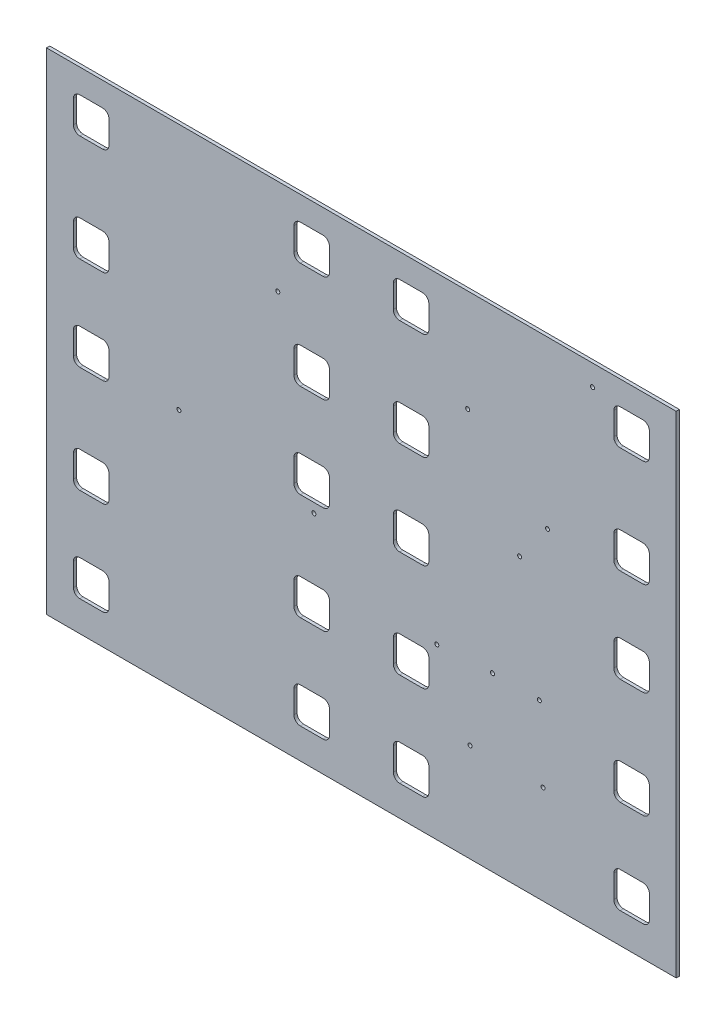
from build123d import *

# Parameters (mm, degrees)
BOSS_EXTRUDE2_DEPTH  = 3.175
CUT_EXTRUDE6_DEPTH   = 570.66376491
LPATTERN2_COUNT      = 2
LPATTERN2_PITCH      = 217.5764
MIRROR1_COPY_1_DEPTH = 570.66376491
SKETCH11_R           = 1.9939
CUT_EXTRUDE7_DEPTH   = 570.66376491


with BuildPart() as part:
    # Sketch9 → Boss-Extrude2 (new body)
    with BuildSketch(Plane.XY):
        Polygon((-144.32459706, -311.513538284), (476.933999514, -311.448288512), (476.883139425, 172.802708817), (-144.375457148, 172.737459045), align=None)
    extrude(amount=BOSS_EXTRUDE2_DEPTH)

    # Sketch10 → Cut-Extrude6 (cut, through all)
    with BuildSketch(Plane.XY.offset(3.175)):
        with BuildLine():
            ThreePointArc((-111.536959772, -153.814293782), (-116.026892468, -155.674637302), (-117.886292807, -160.164960678))
            Line((-117.886292807, -160.164960678), (-117.883937231, -182.592960554))
            ThreePointArc((-117.883937231, -182.592960554), (-116.023593711, -187.08289325), (-111.533270336, -188.942293589))
            Line((-111.533270336, -188.942293589), (-89.105270459, -188.939938013))
            ThreePointArc((-89.105270459, -188.939938013), (-84.615337763, -187.079594493), (-82.755937424, -182.589271118))
            Line((-82.755937424, -182.589271118), (-82.758293001, -160.161271241))
            ThreePointArc((-82.758293001, -160.161271241), (-84.618636521, -155.671338545), (-89.108959896, -153.811938206))
            Line((-89.108959896, -153.811938206), (-111.536959772, -153.814293782))
        make_face()
        with BuildLine():
            ThreePointArc((-111.52723579, -246.397293272), (-116.017168486, -248.257636792), (-117.876568825, -252.747960167))
            Line((-117.876568825, -252.747960167), (-117.874213249, -275.175960043))
            ThreePointArc((-117.874213249, -275.175960043), (-116.013869729, -279.66589274), (-111.523546354, -281.525293078))
            Line((-111.523546354, -281.525293078), (-89.095546477, -281.522937502))
            ThreePointArc((-89.095546477, -281.522937502), (-84.605613781, -279.662593982), (-82.746213443, -275.172270607))
            Line((-82.746213443, -275.172270607), (-82.748569019, -252.744270731))
            ThreePointArc((-82.748569019, -252.744270731), (-84.608912539, -248.254338034), (-89.099235914, -246.394937696))
            Line((-89.099235914, -246.394937696), (-111.52723579, -246.397293272))
        make_face()
        with BuildLine():
            ThreePointArc((-82.769334554, -55.030671821), (-84.629678074, -50.540739125), (-89.120001449, -48.681338786))
            Line((-89.120001449, -48.681338786), (-111.548001325, -48.683694362))
            ThreePointArc((-111.548001325, -48.683694362), (-116.037934022, -50.544037882), (-117.89733436, -55.034361257))
            Line((-117.89733436, -55.034361257), (-117.894978784, -77.462361134))
            ThreePointArc((-117.894978784, -77.462361134), (-116.034635264, -81.95229383), (-111.544311889, -83.811694169))
            Line((-111.544311889, -83.811694169), (-89.116312013, -83.809338593))
            ThreePointArc((-89.116312013, -83.809338593), (-84.626379316, -81.948995073), (-82.766978978, -77.458671698))
            Line((-82.766978978, -77.458671698), (-82.769334554, -55.030671821))
        make_face()
        with BuildLine():
            ThreePointArc((-89.137077548, 113.904260317), (-84.647144851, 115.764603837), (-82.787744513, 120.254927212))
            Line((-82.787744513, 120.254927212), (-82.790100089, 142.682927088))
            ThreePointArc((-82.790100089, 142.682927088), (-84.650443609, 147.172859785), (-89.140766984, 149.032260123))
            Line((-89.140766984, 149.032260123), (-111.56876686, 149.029904547))
            ThreePointArc((-111.56876686, 149.029904547), (-116.058699557, 147.169561027), (-117.918099895, 142.679237652))
            Line((-117.918099895, 142.679237652), (-117.915744319, 120.251237776))
            ThreePointArc((-117.915744319, 120.251237776), (-116.055400799, 115.761305079), (-111.565077424, 113.901904741))
            Line((-111.565077424, 113.901904741), (-89.137077548, 113.904260317))
        make_face()
        with BuildLine():
            ThreePointArc((-117.904702766, 15.120638356), (-116.044359246, 10.630705659), (-111.554035871, 8.771305321))
            Line((-111.554035871, 8.771305321), (-89.126035995, 8.773660897))
            ThreePointArc((-89.126035995, 8.773660897), (-84.636103298, 10.634004417), (-82.77670296, 15.124327792))
            Line((-82.77670296, 15.124327792), (-82.779058536, 37.552327668))
            ThreePointArc((-82.779058536, 37.552327668), (-84.639402056, 42.042260365), (-89.129725431, 43.901660703))
            Line((-89.129725431, 43.901660703), (-111.557725307, 43.899305127))
            ThreePointArc((-111.557725307, 43.899305127), (-116.047658004, 42.038961607), (-117.907058342, 37.548638232))
            Line((-117.907058342, 37.548638232), (-117.904702766, 15.120638356))
        make_face()
    cut_extrude6 = extrude(amount=-CUT_EXTRUDE6_DEPTH, mode=Mode.SUBTRACT)

    # LPattern2: Cut-Extrude6 ×2
    with Locations(*[Vector(0.9999999944845218, 0.00010502836011308132, 0) * (i * LPATTERN2_PITCH) for i in range(1, LPATTERN2_COUNT)]):
        add(cut_extrude6, mode=Mode.SUBTRACT)

    # Mirror1: Cut-Extrude6 across plane
    add(cut_extrude6.mirror(Plane(origin=(166.271985063, 0.017463274, 0), x_dir=(0, 0, 1), z_dir=(-0.9999999944845219, -0.00010502836011320445, 0))), mode=Mode.SUBTRACT)

    # Mirror1 copy 1 sketch → Mirror1 copy 1 (cut, through all)
    with BuildSketch(Plane(origin=(114.967571327, 0.012074856, 3.175), x_dir=(-0.9999999779380877, -0.00021005671906784565, 0), z_dir=(0, 0, 1))):
        with BuildLine():
            ThreePointArc((-111.536959772, 153.814293782), (-116.026892468, 155.674637302), (-117.886292807, 160.164960678))
            Line((-117.886292807, 160.164960678), (-117.883937231, 182.592960554))
            ThreePointArc((-117.883937231, 182.592960554), (-116.023593711, 187.08289325), (-111.533270336, 188.942293589))
            Line((-111.533270336, 188.942293589), (-89.105270459, 188.939938013))
            ThreePointArc((-89.105270459, 188.939938013), (-84.615337763, 187.079594493), (-82.755937424, 182.589271118))
            Line((-82.755937424, 182.589271118), (-82.758293001, 160.161271241))
            ThreePointArc((-82.758293001, 160.161271241), (-84.618636521, 155.671338545), (-89.108959896, 153.811938206))
            Line((-89.108959896, 153.811938206), (-111.536959772, 153.814293782))
        make_face()
        with BuildLine():
            ThreePointArc((-111.52723579, 246.397293272), (-116.017168486, 248.257636792), (-117.876568825, 252.747960167))
            Line((-117.876568825, 252.747960167), (-117.874213249, 275.175960043))
            ThreePointArc((-117.874213249, 275.175960043), (-116.013869729, 279.66589274), (-111.523546354, 281.525293078))
            Line((-111.523546354, 281.525293078), (-89.095546477, 281.522937502))
            ThreePointArc((-89.095546477, 281.522937502), (-84.605613781, 279.662593982), (-82.746213443, 275.172270607))
            Line((-82.746213443, 275.172270607), (-82.748569019, 252.744270731))
            ThreePointArc((-82.748569019, 252.744270731), (-84.608912539, 248.254338034), (-89.099235914, 246.394937696))
            Line((-89.099235914, 246.394937696), (-111.52723579, 246.397293272))
        make_face()
        with BuildLine():
            ThreePointArc((-82.769334554, 55.030671821), (-84.629678074, 50.540739125), (-89.120001449, 48.681338786))
            Line((-89.120001449, 48.681338786), (-111.548001325, 48.683694362))
            ThreePointArc((-111.548001325, 48.683694362), (-116.037934022, 50.544037882), (-117.89733436, 55.034361257))
            Line((-117.89733436, 55.034361257), (-117.894978784, 77.462361134))
            ThreePointArc((-117.894978784, 77.462361134), (-116.034635264, 81.95229383), (-111.544311889, 83.811694169))
            Line((-111.544311889, 83.811694169), (-89.116312013, 83.809338593))
            ThreePointArc((-89.116312013, 83.809338593), (-84.626379316, 81.948995073), (-82.766978978, 77.458671698))
            Line((-82.766978978, 77.458671698), (-82.769334554, 55.030671821))
        make_face()
        with BuildLine():
            ThreePointArc((-89.137077548, -113.904260317), (-84.647144851, -115.764603837), (-82.787744513, -120.254927212))
            Line((-82.787744513, -120.254927212), (-82.790100089, -142.682927088))
            ThreePointArc((-82.790100089, -142.682927088), (-84.650443609, -147.172859785), (-89.140766984, -149.032260123))
            Line((-89.140766984, -149.032260123), (-111.56876686, -149.029904547))
            ThreePointArc((-111.56876686, -149.029904547), (-116.058699557, -147.169561027), (-117.918099895, -142.679237652))
            Line((-117.918099895, -142.679237652), (-117.915744319, -120.251237776))
            ThreePointArc((-117.915744319, -120.251237776), (-116.055400799, -115.761305079), (-111.565077424, -113.901904741))
            Line((-111.565077424, -113.901904741), (-89.137077548, -113.904260317))
        make_face()
        with BuildLine():
            ThreePointArc((-117.904702766, -15.120638356), (-116.044359246, -10.630705659), (-111.554035871, -8.771305321))
            Line((-111.554035871, -8.771305321), (-89.126035995, -8.773660897))
            ThreePointArc((-89.126035995, -8.773660897), (-84.636103298, -10.634004417), (-82.77670296, -15.124327792))
            Line((-82.77670296, -15.124327792), (-82.779058536, -37.552327668))
            ThreePointArc((-82.779058536, -37.552327668), (-84.639402056, -42.042260365), (-89.129725431, -43.901660703))
            Line((-89.129725431, -43.901660703), (-111.557725307, -43.899305127))
            ThreePointArc((-111.557725307, -43.899305127), (-116.047658004, -42.038961607), (-117.907058342, -37.548638232))
            Line((-117.907058342, -37.548638232), (-117.904702766, -15.120638356))
        make_face()
    extrude(amount=-MIRROR1_COPY_1_DEPTH, mode=Mode.SUBTRACT)

    # Sketch11 → Cut-Extrude7 (cut, through all)
    with BuildSketch(Plane.XY.offset(3.175)):
        with Locations((295.653660134, -141.604827152)):
            Circle(SKETCH11_R)
        with Locations((394.335307404, 152.15653884)):
            Circle(SKETCH11_R)
        with Locations((271.193740547, 71.85610504)):
            Circle(SKETCH11_R)
        with Locations((83.796928701, 78.623923098)):
            Circle(SKETCH11_R)
        with Locations((-13.737316507, -71.386321592)):
            Circle(SKETCH11_R)
        with Locations((349.92386483, 8.788864322)):
            Circle(SKETCH11_R)
        with Locations((322.427764053, -28.338005221)):
            Circle(SKETCH11_R)
        with Locations((341.853659879, -141.599974842)):
            Circle(SKETCH11_R)
        with Locations((345.511300672, -214.349591087)):
            Circle(SKETCH11_R)
        with Locations((119.406061758, -93.07123788)):
            Circle(SKETCH11_R)
        with Locations((240.696463223, -144.493499232)):
            Circle(SKETCH11_R)
        with Locations((273.511301069, -214.357153129)):
            Circle(SKETCH11_R)
    extrude(amount=-CUT_EXTRUDE7_DEPTH, mode=Mode.SUBTRACT)


solid = part.part
